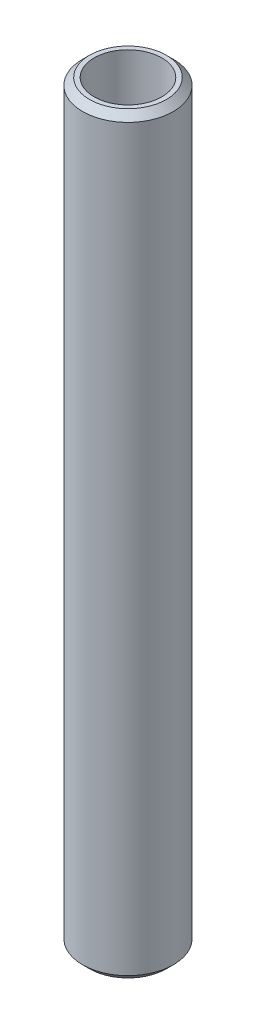
from build123d import *

# Parameters (mm, degrees)
SKETCH1_R           = 22.5
BOSS_EXTRUDE1_DEPTH = 373.490931075
SKETCH2_R           = 16.784367754
CUT_EXTRUDE1_DEPTH  = 375.843934985
CHAMFER1_SIZE       = 3.444842413


with BuildPart() as part:
    # Sketch1 → Boss-Extrude1 (new body)
    with BuildSketch(Plane(origin=(0, 0, 0), x_dir=(1, 0, 0), z_dir=(0, 1, 0))):
        Circle(SKETCH1_R)
    extrude(amount=BOSS_EXTRUDE1_DEPTH)

    # Sketch2 → Cut-Extrude1 (cut, through all)
    with BuildSketch(Plane(origin=(0, 0, 0), x_dir=(1, 0, 0), z_dir=(0, 1, 0))):
        Circle(SKETCH2_R)
    extrude(amount=CUT_EXTRUDE1_DEPTH, mode=Mode.SUBTRACT)

    # Chamfer1
    chamfer1_edges = [part.edges().sort_by_distance(p)[0] for p in [
        (-22.5, 373.490931075, 0),
        (-22.5, 0, 0),
    ]]
    chamfer(chamfer1_edges, length=CHAMFER1_SIZE)


solid = part.part
